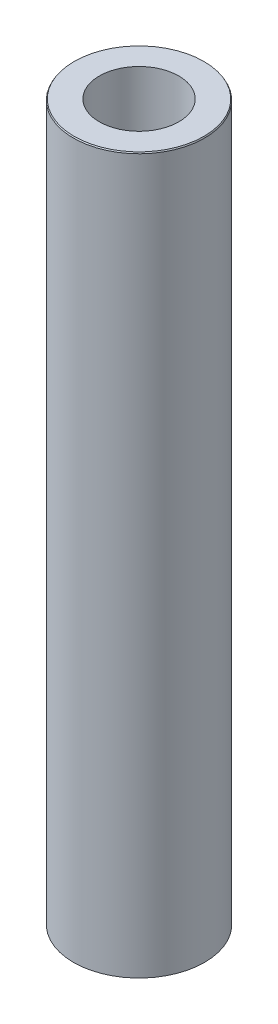
from build123d import *
from OCP.BRepFilletAPI import BRepFilletAPI_MakeChamfer

# Parameters (mm, degrees)
SKETCH1_R           = 17.5
BOSS_EXTRUDE1_DEPTH = 190.99764668
SKETCH2_R           = 10.606453553
CUT_EXTRUDE1_DEPTH  = 193.594395135
CHAMFER1_SIZE       = 0.316769097
CHAMFER1_SIZE2      = 0.182886724


with BuildPart() as part:
    # Sketch1 → Boss-Extrude1 (new body)
    with BuildSketch(Plane(origin=(0, 0, 0), x_dir=(1, 0, 0), z_dir=(0, 1, 0))):
        Circle(SKETCH1_R)
    extrude(amount=BOSS_EXTRUDE1_DEPTH)

    # Sketch2 → Cut-Extrude1 (cut, through all)
    with BuildSketch(Plane(origin=(0, 0, 0), x_dir=(1, 0, 0), z_dir=(0, 1, 0))):
        Circle(SKETCH2_R)
    extrude(amount=CUT_EXTRUDE1_DEPTH, mode=Mode.SUBTRACT)

    # Chamfer1: one chamfer whose edges measure the first distance from different faces: ONE call of the kernel's chamfer builder (chamfer() names one face for all edges)
    chamfer1_edges_1 = [part.edges().sort_by_distance(p)[0] for p in [
        (-17.5, 190.99764668, 0),
    ]]
    chamfer1_side_1 = [part.faces().sort_by_distance(p)[0] for p in [
        (-17.5, 95.49882334, 0),
    ]]
    chamfer1_edges_2 = [part.edges().sort_by_distance(p)[0] for p in [
        (-17.5, 0, 0),
    ]]
    chamfer1_side_2 = [part.faces().sort_by_distance(p)[0] for p in [
        (-17.005025253, 0, 0),
    ]]
    chamfer1 = BRepFilletAPI_MakeChamfer(part.part.solid().wrapped)
    for e in chamfer1_edges_1:
        chamfer1.Add(CHAMFER1_SIZE, CHAMFER1_SIZE2, e.wrapped, chamfer1_side_1[0].wrapped)  # the first distance lies on this face
    for e in chamfer1_edges_2:
        chamfer1.Add(CHAMFER1_SIZE, CHAMFER1_SIZE2, e.wrapped, chamfer1_side_2[0].wrapped)  # the first distance lies on this face
    add(Compound.cast(chamfer1.Shape()), mode=Mode.REPLACE)


solid = part.part
